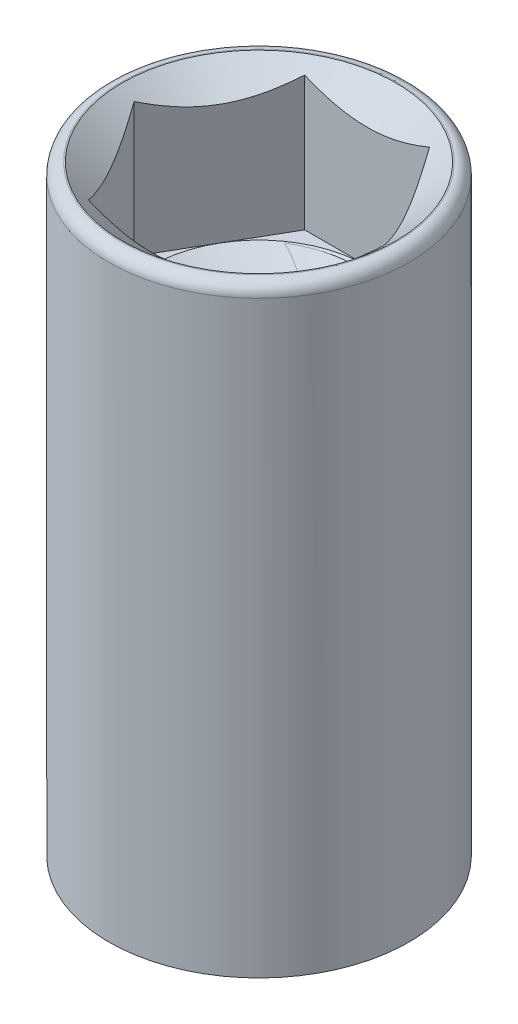
from build123d import *

# Parameters (mm, degrees)
REDONDEO1_R           = 0.5
CORTAR_EXTRUIR1_DEPTH = 6
CORTAR_BARRER1_PITCH  = 1.25


with BuildPart() as part:
    # Croquis1 → Revolución1 (revolve)
    with BuildSketch(Plane.XY, mode=Mode.PRIVATE) as revoluci_n1_sk:
        Polygon((5.7, 0), (6.25, 0), (6.25, -25), (3.375, -25), (3.375, -6.649519053), (4.5, -6), (4.5, -1), align=None)
    revolve(revoluci_n1_sk.sketch.rotate(Axis((0, -8.598076211, 0), (0, -1, 0)), 180), axis=Axis((0, -8.598076211, 0), (0, -1, 0)))

    # Redondeo1
    redondeo1_edges = [part.edges().sort_by_distance(p)[0] for p in [
        (6.25, 0, 0),
    ]]
    fillet(redondeo1_edges, radius=REDONDEO1_R)

    # Croquis2 → Cortar-Extruir1 (cut)
    with BuildSketch(Plane(origin=(0, 0, 0), x_dir=(1, 0, 0), z_dir=(0, 1, 0))):
        Polygon((5.196152423, 0), (2.598076211, 4.5), (-2.598076211, 4.5), (-5.196152423, 0), (-2.598076211, -4.5), (2.598076211, -4.5), align=None)
    extrude(amount=-CORTAR_EXTRUIR1_DEPTH, mode=Mode.SUBTRACT)

    # Cortar-Barrer1: the profile of Croquis4 screwed along a right-hand helix of 36 turns, 8 arcs to a turn; built about Z, then put on its axis
    cortar_barrer1_z = Axis((0, 0, 0), (0, 0, 1))
    cortar_barrer1_corners = [(3.396321355, 8.173e-05, -0.001386523), (3.382538266, -0.072374438, 1.22780342), (4.454085893, -0.033450336, 0.567471585)]
    with BuildLine(mode=Mode.PRIVATE) as cortar_barrer1_profile:
        Line(cortar_barrer1_corners[0], cortar_barrer1_corners[1])
        Line(cortar_barrer1_corners[1], cortar_barrer1_corners[2])
        Line(cortar_barrer1_corners[2], cortar_barrer1_corners[0])
    cortar_barrer1_cap = Face(cortar_barrer1_profile.wire())
    cortar_barrer1_turn_angles = [0, 22.5, 45, 67.5, 90, 112.5, 135, 157.5, 180, 202.5, 225, 247.5, 270, 292.5, 315, 337.5, 360]
    cortar_barrer1_turn_weights = [1, 0.9238795325112867, 1, 0.9238795325112867, 1, 0.9238795325112867, 1, 0.9238795325112867, 1, 0.9238795325112867, 1, 0.9238795325112867, 1, 0.9238795325112867, 1, 0.9238795325112867, 1]
    cortar_barrer1_turn_rails = [Edge.make_bspline([Vector(p[0], p[1], 0).rotate(cortar_barrer1_z, cortar_barrer1_turn_angles[k]) / cortar_barrer1_turn_weights[k] + Vector(0, 0, p[2] + CORTAR_BARRER1_PITCH * cortar_barrer1_turn_angles[k] / 360) for k in range(17)], [0, 0, 0, 1, 1, 2, 2, 3, 3, 4, 4, 5, 5, 6, 6, 7, 7, 8, 8, 8], 2, cortar_barrer1_turn_weights) for p in cortar_barrer1_corners]
    cortar_barrer1_turn_sides = [Face.make_surface_from_curves(cortar_barrer1_turn_rails[p[0]], cortar_barrer1_turn_rails[p[1]]) for p in [(0, 1), (1, 2), (2, 0)]]
    cortar_barrer1 = Plane(origin=(0, -35, 0), x_dir=(-0.7071067811865512, 0, 0.7071067811865438), z_dir=(0, 1, 0)) * Solid(Shell([*[p.moved(Location((0, 0, CORTAR_BARRER1_PITCH * i))) for i in range(36) for p in cortar_barrer1_turn_sides], cortar_barrer1_cap, cortar_barrer1_cap.rotate(cortar_barrer1_z, 12960).moved(Location((0, 0, CORTAR_BARRER1_PITCH * 12960 / 360)))]))
    add(cortar_barrer1, mode=Mode.SUBTRACT)


solid = part.part
